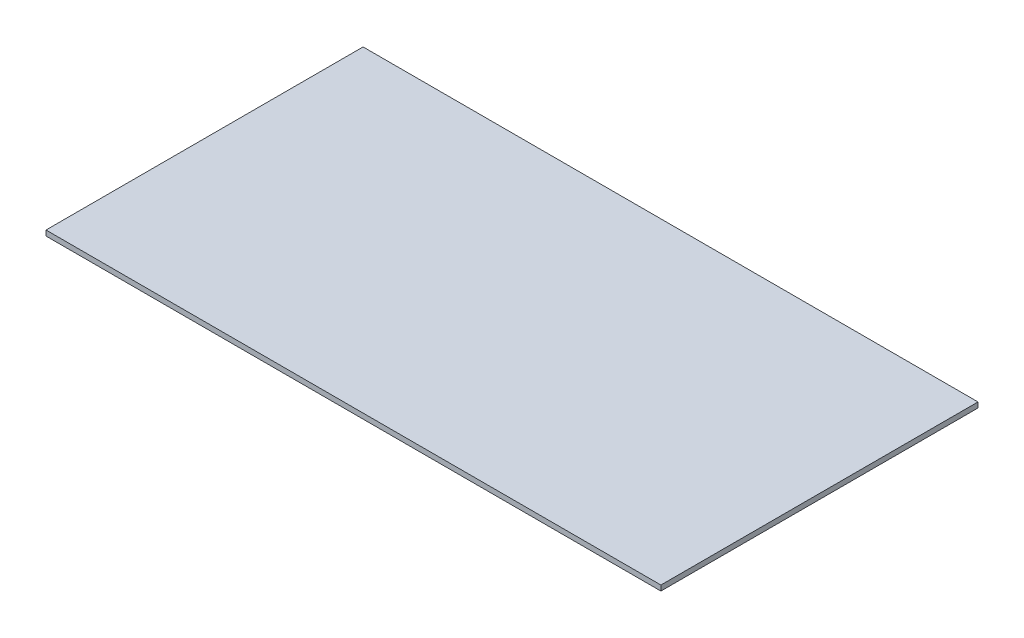
from build123d import *

# Parameters (mm, degrees)
SKETCH1_W           = 350.986131094
SKETCH1_H           = 181
BOSS_EXTRUDE1_DEPTH = 3


with BuildPart() as part:
    # Sketch1 → Boss-Extrude1 (new body)
    with BuildSketch(Plane(origin=(0, 0, 0), x_dir=(1, 0, 0), z_dir=(0, 1, 0))):
        with Locations((144.965950846, 90.5)):
            Rectangle(SKETCH1_W, SKETCH1_H)
    extrude(amount=BOSS_EXTRUDE1_DEPTH)


solid = part.part
